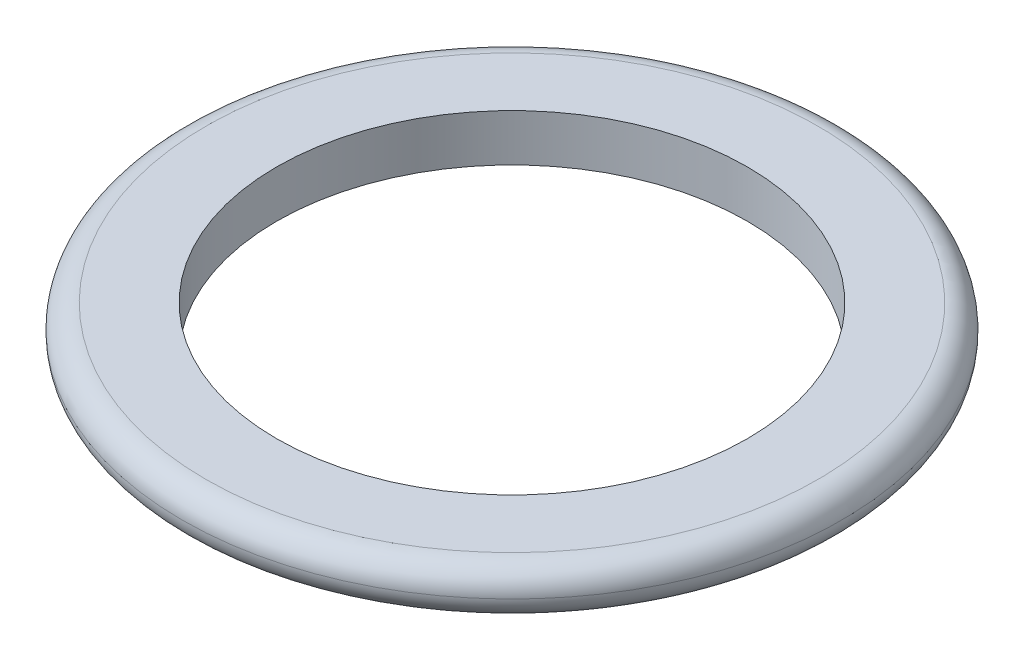
from build123d import *

# Parameters (mm, degrees)
SKETCH_1_R      = 7
SKETCH_1_R_2    = 5
EXTRUDE_1_DEPTH = 1
FILLET_1_R      = 0.5


with BuildPart() as part:
    # 草图1 → 凸台-拉伸1 (new body)
    with BuildSketch(Plane(origin=(0, 0, 0), x_dir=(1, 0, 0), z_dir=(0, 1, 0))):
        with Locations(Location((0, 0, 0), (0, 0, 270))):
            Circle(SKETCH_1_R)
        with Locations(Location((0, 0, 0), (0, 0, 270))):
            Circle(SKETCH_1_R_2, mode=Mode.SUBTRACT)
    extrude(amount=EXTRUDE_1_DEPTH)

    # 圆角1
    fillet_1_edges = [part.edges().sort_by_distance(p)[0] for p in [
        (0, 0, -7),
        (0, 1, -7),
    ]]
    fillet(fillet_1_edges, radius=FILLET_1_R - 0.0001)  # a hair under: the kernel refuses the full size


solid = part.part
